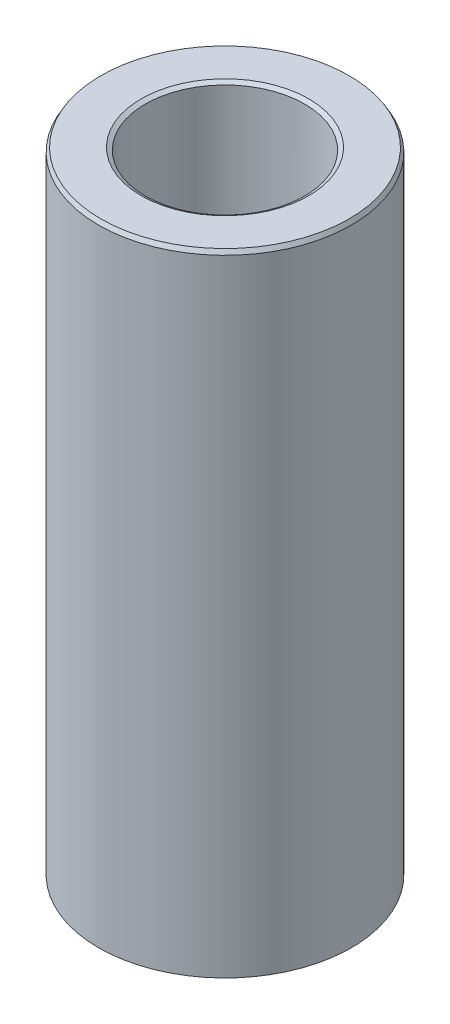
from build123d import *
from OCP.BRepFilletAPI import BRepFilletAPI_MakeChamfer

# Parameters (mm, degrees)
SKETCH1_R           = 27.5
BOSS_EXTRUDE1_DEPTH = 137.492743222
SKETCH2_R           = 17.325339115
CUT_EXTRUDE1_DEPTH  = 143.8872088
CHAMFER1_SIZE       = 0.90438614
CHAMFER1_SIZE2      = 0.522147581


with BuildPart() as part:
    # Sketch1 → Boss-Extrude1 (new body)
    with BuildSketch(Plane(origin=(0, 0, 0), x_dir=(1, 0, 0), z_dir=(0, 1, 0))):
        Circle(SKETCH1_R)
    extrude(amount=BOSS_EXTRUDE1_DEPTH)

    # Sketch2 → Cut-Extrude1 (cut, through all)
    with BuildSketch(Plane(origin=(0, 0, 0), x_dir=(1, 0, 0), z_dir=(0, 1, 0))):
        Circle(SKETCH2_R)
    extrude(amount=CUT_EXTRUDE1_DEPTH, mode=Mode.SUBTRACT)

    # Chamfer1: one chamfer whose edges measure the first distance from different faces: ONE call of the kernel's chamfer builder (chamfer() names one face for all edges)
    chamfer1_edges_1 = [part.edges().sort_by_distance(p)[0] for p in [
        (-17.325339115, 137.492743222, 0),
    ]]
    chamfer1_side_1 = [part.faces().sort_by_distance(p)[0] for p in [
        (-26.722182541, 137.492743222, 0),
    ]]
    chamfer1_edges_2 = [part.edges().sort_by_distance(p)[0] for p in [
        (-17.325339115, 0, 0),
    ]]
    chamfer1_side_2 = [part.faces().sort_by_distance(p)[0] for p in [
        (-17.325339115, 68.746371611, 0),
    ]]
    chamfer1_edges_3 = [part.edges().sort_by_distance(p)[0] for p in [
        (-27.5, 0, 0),
    ]]
    chamfer1_side_3 = [part.faces().sort_by_distance(p)[0] for p in [
        (-26.722182541, 0, 0),
    ]]
    chamfer1_edges_4 = [part.edges().sort_by_distance(p)[0] for p in [
        (-27.5, 137.492743222, 0),
    ]]
    chamfer1_side_4 = [part.faces().sort_by_distance(p)[0] for p in [
        (-27.5, 68.746371611, 0),
    ]]
    chamfer1 = BRepFilletAPI_MakeChamfer(part.part.solid().wrapped)
    for e in chamfer1_edges_1:
        chamfer1.Add(CHAMFER1_SIZE, CHAMFER1_SIZE2, e.wrapped, chamfer1_side_1[0].wrapped)  # the first distance lies on this face
    for e in chamfer1_edges_2:
        chamfer1.Add(CHAMFER1_SIZE, CHAMFER1_SIZE2, e.wrapped, chamfer1_side_2[0].wrapped)  # the first distance lies on this face
    for e in chamfer1_edges_3:
        chamfer1.Add(CHAMFER1_SIZE, CHAMFER1_SIZE2, e.wrapped, chamfer1_side_3[0].wrapped)  # the first distance lies on this face
    for e in chamfer1_edges_4:
        chamfer1.Add(CHAMFER1_SIZE, CHAMFER1_SIZE2, e.wrapped, chamfer1_side_4[0].wrapped)  # the first distance lies on this face
    add(Compound.cast(chamfer1.Shape()), mode=Mode.REPLACE)


solid = part.part
